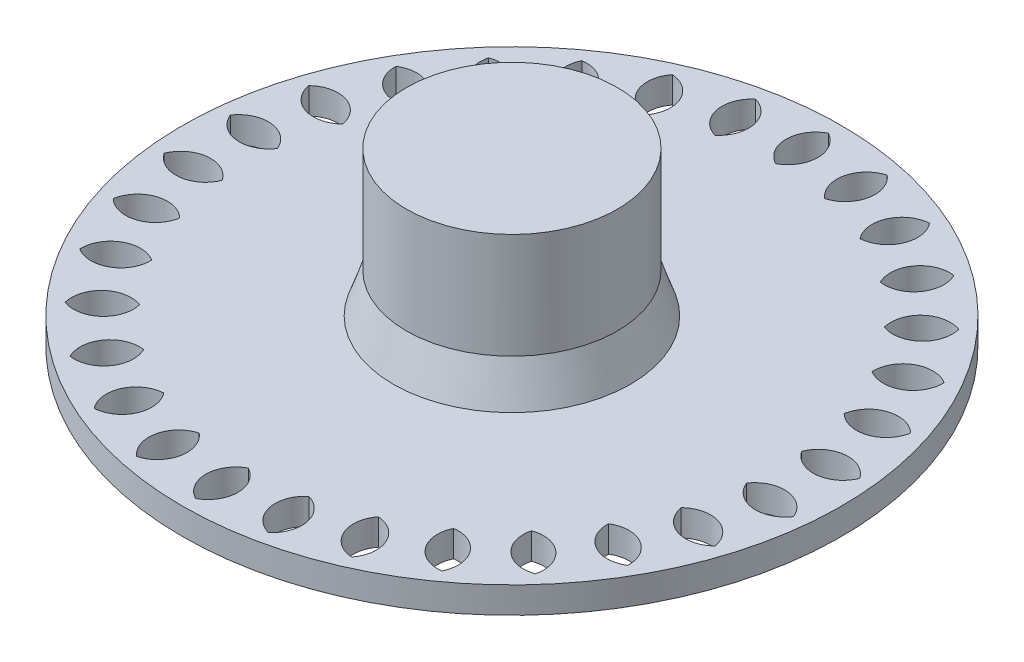
from build123d import *

# Parameters (mm, degrees)
SKETCH2_R           = 25
BOSS_EXTRUDE1_DEPTH = 2
CUT_EXTRUDE1_DEPTH  = 36.411862419
CIRPATTERN1_COUNT   = 30
SKETCH5_R           = 8
BOSS_EXTRUDE2_DEPTH = 8


with BuildPart() as part:
    # Sketch2 → Boss-Extrude1 (new body)
    with BuildSketch(Plane(origin=(0, 0, 0), x_dir=(1, 0, 0), z_dir=(0, 1, 0))):
        Circle(SKETCH2_R)
    extrude(amount=BOSS_EXTRUDE1_DEPTH)

    # Sketch1 → Cut-Extrude1 (cut, through all)
    with BuildSketch(Plane(origin=(0, 0, 0), x_dir=(1, 0, 0), z_dir=(0, 1, 0))):
        with BuildLine():
            ThreePointArc((0, 20), (-1.208132069, 22), (0, 24))
            ThreePointArc((0, 24), (1.208132069, 22), (0, 20))
        make_face()
    cut_extrude1 = extrude(amount=CUT_EXTRUDE1_DEPTH, mode=Mode.SUBTRACT)

    # CirPattern1: Cut-Extrude1 ×30 about axis
    cirpattern1_axis = Axis((0, 2, 0), (0, -1, 0))
    for i in range(1, CIRPATTERN1_COUNT):
        add(cut_extrude1.rotate(cirpattern1_axis, i * 360 / CIRPATTERN1_COUNT), mode=Mode.SUBTRACT)

    # Sketch4 → Revolve1 (revolve)
    with BuildSketch(Plane.XY):
        Polygon((-8, 5), (0, 5), (0, 2), (-9, 2), align=None)
    revolve(axis=Axis((0, 5, 0), (0, -1, 0)))

    # Sketch5 → Boss-Extrude2 (add)
    with BuildSketch(Plane(origin=(0, 5, 0), x_dir=(1, 0, 0), z_dir=(0, 1, 0))):
        Circle(SKETCH5_R)
    extrude(amount=BOSS_EXTRUDE2_DEPTH)


solid = part.part
